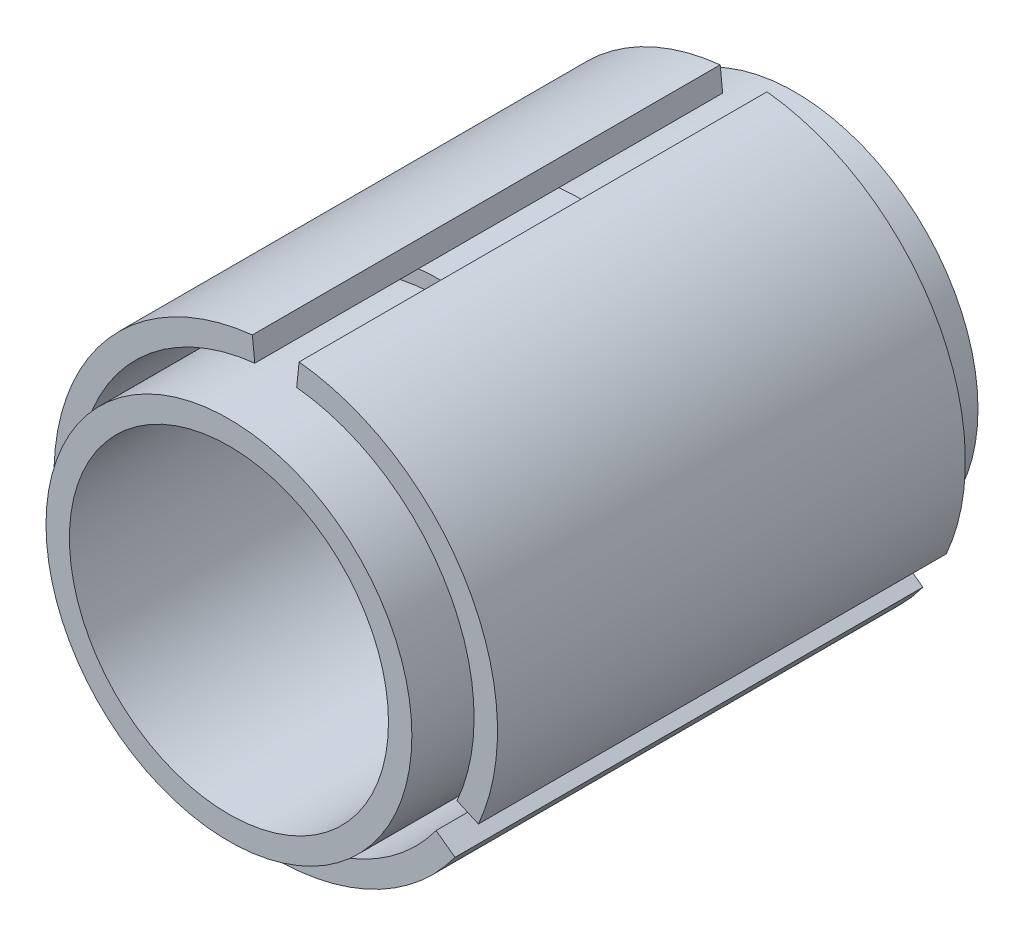
from build123d import *

# Parameters (mm, degrees)
CROQUIS1_R                   = 42.4
SALIENTE_EXTRUIR1_DEPTH      = 15
SALIENTE_EXTRUIR2_DEPTH      = 15
SALIENTE_EXTRUIR3_DEPTH      = 50
SALIENTE_EXTRUIR4_DEPTH      = 60
SALIENTE_EXTRUIR4_DEPTH_BACK = 61
CROQUIS4_R                   = 39.1
CROQUIS5_R                   = 34.1
CORTAR_EXTRUIR1_DEPTH        = 58
CORTAR_EXTRUIR2_START        = -58
CROQUIS6_R                   = 34.1
CORTAR_EXTRUIR2_DEPTH        = 58
CORTAR_EXTRUIR3_DEPTH        = 91.633989209
CORTAR_EXTRUIR3_DEPTH_BACK   = 91.633989209
CROQUIS7_R                   = 1.75


with BuildPart() as part:
    # Croquis1 → Saliente-Extruir1 (new, symmetric)
    with BuildSketch(Plane.XY):
        Circle(CROQUIS1_R)
    extrude(amount=SALIENTE_EXTRUIR1_DEPTH, both=True)

    # Croquis2 → Saliente-Extruir2 (add, symmetric)
    with BuildSketch(Plane.XY):
        with BuildLine():
            Line((-5, 47.135549217), (-4.47257384, 42.163444869))
            ThreePointArc((-4.47257384, 42.163444869), (-36.71947712, 21.2), (-38.750901288, -17.208359869))
            Line((-38.750901288, -17.208359869), (-43.320583043, -19.23764759))
            ThreePointArc((-43.320583043, -19.23764759), (-41.049604139, 23.7), (-5, 47.135549217))
        make_face()
        with BuildLine():
            Line((5, 47.135549217), (4.47257384, 42.163444869))
            ThreePointArc((4.47257384, 42.163444869), (36.71947712, 21.2), (38.750901288, -17.208359869))
            Line((38.750901288, -17.208359869), (43.320583043, -19.23764759))
            ThreePointArc((43.320583043, -19.23764759), (41.049604139, 23.7), (5, 47.135549217))
        make_face()
        with BuildLine():
            Line((38.320583043, -27.897901627), (34.278327448, -24.955085))
            ThreePointArc((34.278327448, -24.955085), (0, -42.4), (-34.278327448, -24.955085))
            Line((-34.278327448, -24.955085), (-38.320583043, -27.897901627))
            ThreePointArc((-38.320583043, -27.897901627), (0, -47.4), (38.320583043, -27.897901627))
        make_face()
    extrude(amount=SALIENTE_EXTRUIR2_DEPTH, both=True)

    # Croquis3 → Saliente-Extruir3 (add, symmetric)
    with BuildSketch(Plane.XY):
        with BuildLine():
            Line((-4.47257384, 42.163444869), (-5, 47.135549217))
            ThreePointArc((-5, 47.135549217), (-41.049604139, 23.7), (-43.320583043, -19.23764759))
            Line((-43.320583043, -19.23764759), (-38.750901288, -17.208359869))
            ThreePointArc((-38.750901288, -17.208359869), (-36.71947712, 21.2), (-4.47257384, 42.163444869))
        make_face()
        with BuildLine():
            Line((4.47257384, 42.163444869), (5, 47.135549217))
            ThreePointArc((5, 47.135549217), (41.049604139, 23.7), (43.320583043, -19.23764759))
            Line((43.320583043, -19.23764759), (38.750901288, -17.208359869))
            ThreePointArc((38.750901288, -17.208359869), (36.71947712, 21.2), (4.47257384, 42.163444869))
        make_face()
        with BuildLine():
            Line((38.320583043, -27.897901627), (34.278327448, -24.955085))
            ThreePointArc((34.278327448, -24.955085), (0, -42.4), (-34.278327448, -24.955085))
            Line((-34.278327448, -24.955085), (-38.320583043, -27.897901627))
            ThreePointArc((-38.320583043, -27.897901627), (0, -47.4), (38.320583043, -27.897901627))
        make_face()
    extrude(amount=SALIENTE_EXTRUIR3_DEPTH, both=True)

    # Croquis4 → Saliente-Extruir4 (add, two sides: drawn at the far end of the back side and taken through both)
    with BuildSketch(Plane.XY.offset(-SALIENTE_EXTRUIR4_DEPTH_BACK)):
        Circle(CROQUIS4_R)
    extrude(amount=SALIENTE_EXTRUIR4_DEPTH + SALIENTE_EXTRUIR4_DEPTH_BACK)

    # Croquis5 → Cortar-Extruir1 (cut)
    with BuildSketch(Plane.XY.offset(60)):
        Circle(CROQUIS5_R)
    extrude(amount=-CORTAR_EXTRUIR1_DEPTH, mode=Mode.SUBTRACT)

    # Croquis6 → Cortar-Extruir2 (cut)
    with BuildSketch(Plane(origin=(0, 0, -61), x_dir=(-1, 0, 0), z_dir=(0, 0, -1)).offset(CORTAR_EXTRUIR2_START)):
        Circle(CROQUIS6_R)
    extrude(amount=CORTAR_EXTRUIR2_DEPTH, mode=Mode.SUBTRACT)

    # Croquis7 → Cortar-Extruir3 (cut, two sides: drawn at the far end of the back side and taken through both)
    with BuildSketch(Plane.XY.offset(-CORTAR_EXTRUIR3_DEPTH_BACK)):
        with Locations((5, 5)):
            Circle(CROQUIS7_R)
        with Locations((-5, 5)):
            Circle(CROQUIS7_R)
        with Locations((-5, -5)):
            Circle(CROQUIS7_R)
        with Locations((5, -5)):
            Circle(CROQUIS7_R)
    extrude(amount=CORTAR_EXTRUIR3_DEPTH + CORTAR_EXTRUIR3_DEPTH_BACK, mode=Mode.SUBTRACT)


solid = part.part
